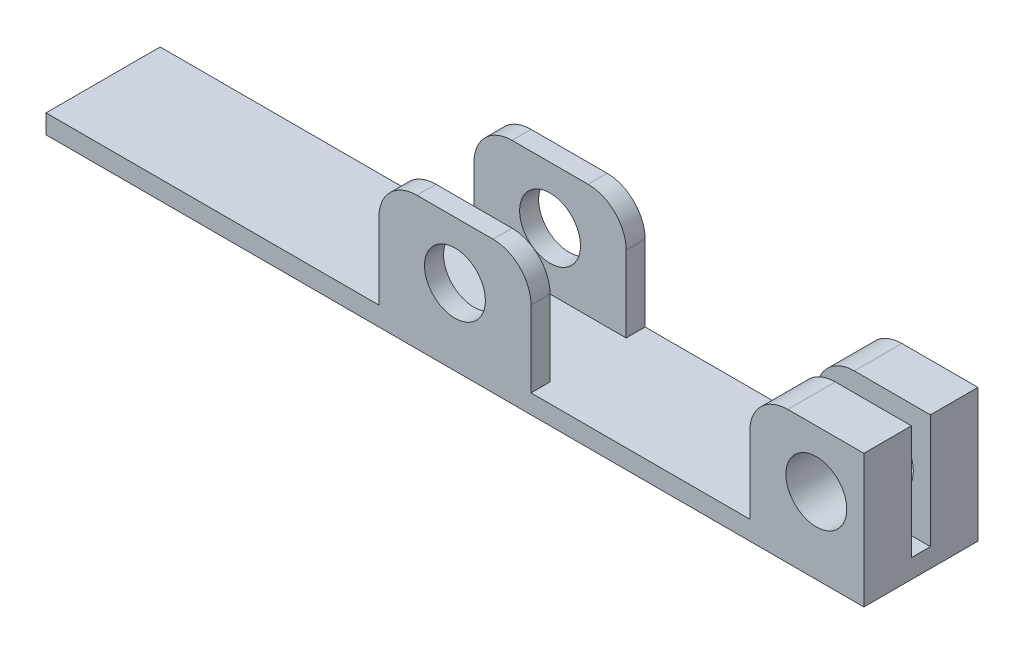
from build123d import *

# Parameters (mm, degrees)
SKETCH2_W           = 215
SKETCH2_H           = 30
BOSS_EXTRUDE1_DEPTH = 5
SKETCH4_W           = 30
SKETCH4_H           = 12.5
SKETCH4_W_2         = 40
SKETCH4_H_2         = 5
BOSS_EXTRUDE2_DEPTH = 30
SKETCH5_R           = 8
BEARING_HOLES_DEPTH = 117.966875653
FILLET1_R           = 10


with BuildPart() as part:
    # Sketch2 → Boss-Extrude1 (new body)
    with BuildSketch(Plane(origin=(0, 0, 0), x_dir=(1, 0, 0), z_dir=(0, 1, 0))):
        Rectangle(SKETCH2_W, SKETCH2_H)
    extrude(amount=BOSS_EXTRUDE1_DEPTH)

    # Sketch4 → Boss-Extrude2 (add)
    with BuildSketch(Plane(origin=(0, 5, 0), x_dir=(1, 0, 0), z_dir=(0, 1, 0))):
        with Locations((92.5, -8.75)):
            Rectangle(SKETCH4_W, SKETCH4_H)
        with Locations((0, -12.5)):
            Rectangle(SKETCH4_W_2, SKETCH4_H_2)
        with Locations((0, 12.5)):
            Rectangle(SKETCH4_W_2, SKETCH4_H_2)
        with Locations((92.5, 8.75)):
            Rectangle(SKETCH4_W, SKETCH4_H)
    extrude(amount=BOSS_EXTRUDE2_DEPTH)

    # Sketch5 → Bearing holes (cut, through all)
    with BuildSketch(Plane.XY.offset(15)):
        with Locations((0, 20)):
            Circle(SKETCH5_R)
        with Locations((95, 20)):
            Circle(SKETCH5_R)
    extrude(amount=-BEARING_HOLES_DEPTH, mode=Mode.SUBTRACT)

    # Fillet1
    fillet1_edges = [part.edges().sort_by_distance(p)[0] for p in [
        (-20, 35, 12.5),
        (-20, 35, -12.5),
        (20, 35, -12.5),
        (20, 35, 12.5),
        (77.5, 35, 8.75),
        (77.5, 35, -8.75),
    ]]
    fillet(fillet1_edges, radius=FILLET1_R)


solid = part.part
